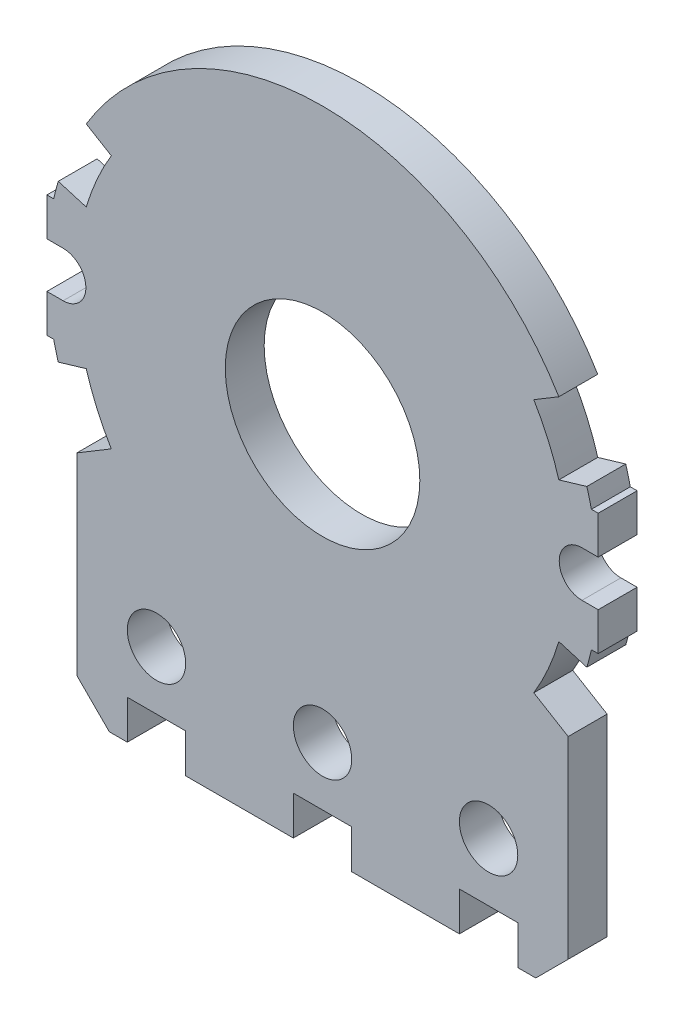
from build123d import *

# Parameters (mm, degrees)
SKETCH1_R           = 3
BOSS_EXTRUDE1_DEPTH = 1.2
SKETCH2_R           = 0.9
SKETCH2_W           = 1.8
SKETCH2_H           = 1.2
CUT_EXTRUDE1_DEPTH  = 15.350609743
CUT_EXTRUDE2_DEPTH  = 10


with BuildPart() as part:
    # Sketch1 → Boss-Extrude1 (new body)
    with BuildSketch(Plane.XY):
        with BuildLine():
            Line((-7.575, -3.856082857), (-7.575, -11.5))
            Line((-7.575, -11.5), (7.575, -11.5))
            Line((7.575, -11.5), (7.575, -3.856082857))
            ThreePointArc((7.575, -3.856082857), (7.994413326, -2.887794239), (8.290619699, -1.875))
            Line((8.290619699, -1.875), (8.5, -1.875))
            Line((8.5, -1.875), (8.5, 1.875))
            Line((8.5, 1.875), (8.290619699, 1.875))
            ThreePointArc((8.290619699, 1.875), (0, 8.5), (-8.290619699, 1.875))
            Line((-8.290619699, 1.875), (-8.5, 1.875))
            Line((-8.5, 1.875), (-8.5, -1.875))
            Line((-8.5, -1.875), (-8.290619699, -1.875))
            ThreePointArc((-8.290619699, -1.875), (-7.994413326, -2.887794239), (-7.575, -3.856082857))
        make_face()
        Circle(SKETCH1_R, mode=Mode.SUBTRACT)
    extrude(amount=BOSS_EXTRUDE1_DEPTH)

    # Sketch2 → Cut-Extrude1 (cut, through all)
    with BuildSketch(Plane.XY.offset(1.2)):
        with Locations((0, -8.5)):
            Circle(SKETCH2_R)
        with Locations((5.12, -8.5)):
            Circle(SKETCH2_R)
        with Locations((-5.12, -8.5)):
            Circle(SKETCH2_R)
        with Locations((5.12, -10.9)):
            Rectangle(SKETCH2_W, SKETCH2_H)
        with Locations((0, -10.9)):
            Rectangle(SKETCH2_W, SKETCH2_H)
        with Locations((-5.12, -10.9)):
            Rectangle(SKETCH2_W, SKETCH2_H)
        Polygon((7.575, -11.5), (7.575, -10.5), (6.575, -11.5), align=None)
        Polygon((-6.575, -11.5), (-7.575, -11.5), (-7.575, -10.5), align=None)
    extrude(amount=-CUT_EXTRUDE1_DEPTH, mode=Mode.SUBTRACT)

    # Sketch3 → Cut-Extrude2 (cut)
    with BuildSketch(Plane.XY.offset(1.2)):
        with BuildLine():
            ThreePointArc((6.514471485, 3.914289369), (6.956367241, 3.060874843), (7.287029985, 2.15851662))
            Line((7.287029985, 2.15851662), (9.119724122, 2.701385355))
            Line((9.119724122, 2.701385355), (8.018790887, 4.818175656))
            Line((8.018790887, 4.818175656), (6.514471485, 3.914289369))
        make_face()
        with BuildLine():
            Line((8.018790887, -4.818175656), (9.119724122, -2.701385355))
            Line((9.119724122, -2.701385355), (7.287029985, -2.15851662))
            ThreePointArc((7.287029985, -2.15851662), (6.956367241, -3.060874843), (6.514471485, -3.914289369))
            Line((6.514471485, -3.914289369), (8.018790887, -4.818175656))
        make_face()
        with BuildLine():
            ThreePointArc((-6.514471485, -3.914289369), (-6.956367241, -3.060874843), (-7.287029985, -2.15851662))
            Line((-7.287029985, -2.15851662), (-9.119724122, -2.701385355))
            Line((-9.119724122, -2.701385355), (-8.018790887, -4.818175656))
            Line((-8.018790887, -4.818175656), (-7.575, -4.551519189))
            Line((-7.575, -4.551519189), (-6.514471485, -3.914289369))
        make_face()
        with BuildLine():
            Line((-6.514471485, 3.914289369), (-8.018790887, 4.818175656))
            Line((-8.018790887, 4.818175656), (-9.119724122, 2.701385355))
            Line((-9.119724122, 2.701385355), (-7.287029985, 2.15851662))
            ThreePointArc((-7.287029985, 2.15851662), (-6.956367241, 3.060874843), (-6.514471485, 3.914289369))
        make_face()
        with BuildLine():
            Line((-9, 0.701713619), (-9, -0.701713619))
            Line((-9, -0.701713619), (-8, -0.701713619))
            ThreePointArc((-8, -0.701713619), (-7.298286381, 0), (-8, 0.701713619))
            Line((-8, 0.701713619), (-9, 0.701713619))
        make_face()
        with BuildLine():
            Line((8, -0.701713619), (9, -0.701713619))
            Line((9, -0.701713619), (9, 0.701713619))
            Line((9, 0.701713619), (8, 0.701713619))
            ThreePointArc((8, 0.701713619), (7.298286381, 0), (8, -0.701713619))
        make_face()
    extrude(amount=-CUT_EXTRUDE2_DEPTH, mode=Mode.SUBTRACT)


solid = part.part
